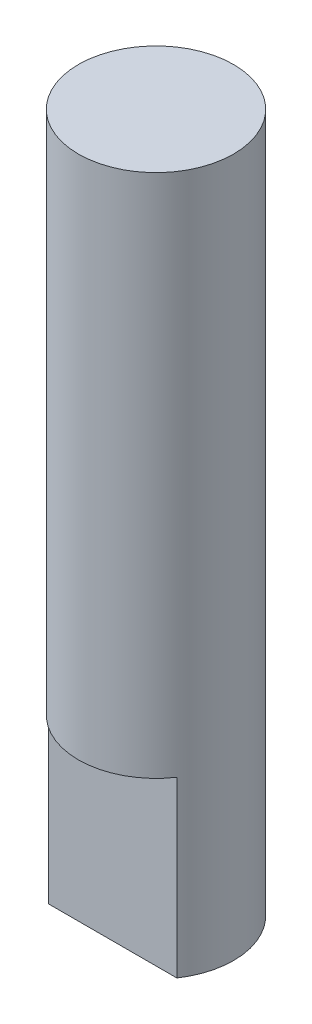
from build123d import *

# Parameters (mm, degrees)
SKETCH1_R           = 3.175
BOSS_EXTRUDE1_DEPTH = 28.575
CUT_EXTRUDE2_DEPTH  = 7.112


with BuildPart() as part:
    # Sketch1 → Boss-Extrude1 (new body)
    with BuildSketch(Plane(origin=(0, 0, 0), x_dir=(1, 0, 0), z_dir=(0, 1, 0))):
        Circle(SKETCH1_R)
    extrude(amount=BOSS_EXTRUDE1_DEPTH)

    # Sketch3 → Cut-Extrude2 (cut)
    with BuildSketch(Plane.XZ):
        Polygon((-2.630464028, 1.778), (2.630464028, 1.778), (2.491358847, 4.844067394), (-3.600848442, 3.874236118), align=None)
    extrude(amount=-CUT_EXTRUDE2_DEPTH, mode=Mode.SUBTRACT)


solid = part.part
